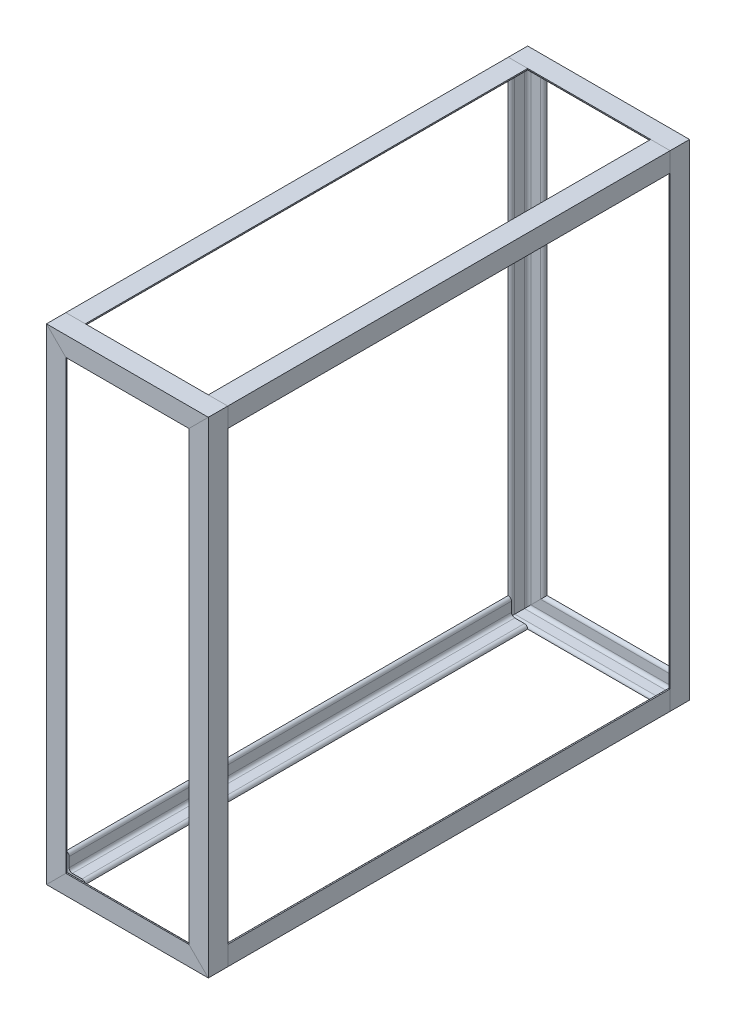
from build123d import *

# Parameters (mm, degrees)
ANGLE_IRON_CONFIGURED_35_X_35_X_5_1_DEPTH      = 293.426406871
ANGLE_IRON_CONFIGURED_35_X_35_X_5_1_DEPTH_BACK = 43.426406871
ANGLE_IRON_CONFIGURED_35_X_35_X_5_1_2_DEPTH    = 836.852813742
ANGLE_IRON_CONFIGURED_35_X_35_X_5_1_3_DEPTH    = 336.852813742
ANGLE_IRON_CONFIGURED_35_X_35_X_5_1_4_DEPTH    = 836.852813742
ANGLE_START                                    = -713.2
ANGLE_IRON_CONFIGURED_35_X_35_X_5_9_DEPTH      = 683.2


# Read off the part's stored shape, not the designer's step: Angle iron - configured 35 X 35 X 5(2)
with BuildPart() as part:
    # Sketch11 → Angle iron - configured 35 X 35 X 5(1) (new, two sides: drawn at the far end of the back side and taken through both)
    with BuildSketch(Plane(origin=(-125, 375, 0), x_dir=(0, -1, 0), z_dir=(1, 0, 0)).offset(-ANGLE_IRON_CONFIGURED_35_X_35_X_5_1_DEPTH_BACK)):
        with BuildLine():
            Line((0, 0), (0, 30))
            ThreePointArc((0, 30), (3.535533906, 28.535533906), (5, 25))
            Line((5, 25), (5, 10))
            ThreePointArc((5, 10), (6.464466094, 6.464466094), (10, 5))
            Line((10, 5), (25, 5))
            ThreePointArc((25, 5), (28.535533906, 3.535533906), (30, 0))
            Line((30, 0), (0, 0))
        make_face()
    extrude(amount=ANGLE_IRON_CONFIGURED_35_X_35_X_5_1_DEPTH + ANGLE_IRON_CONFIGURED_35_X_35_X_5_1_DEPTH_BACK)

    # Angle iron - configured 35 X 35 X 5(1) mi
    split(bisect_by=Plane(origin=(-125, 375, 0), x_dir=(-0.707106781, 0.707106781, 0), z_dir=(0.707106781, 0.707106781, 0)), keep=Keep.TOP)

    # Angle iron - configured 35 X 35 X 5_ 2
    split(bisect_by=Plane(origin=(125, 375, 0), x_dir=(-0.707106781, -0.707106781, 0), z_dir=(-0.707106781, 0.707106781, 0)), keep=Keep.TOP)


with BuildPart() as body_2:
    # Sketch11 on segment 2 (carried to segment 2) → Angle iron - configured 35 X 35 X 5_1 2 (new body)
    with BuildSketch(Plane(origin=(125, 418.426406871, 0), x_dir=(-1, 0, 0), z_dir=(0, -1, 0))):
        with BuildLine():
            Line((0, 0), (0, 30))
            ThreePointArc((0, 30), (3.535533906, 28.535533906), (5, 25))
            Line((5, 25), (5, 10))
            ThreePointArc((5, 10), (6.464466094, 6.464466094), (10, 5))
            Line((10, 5), (25, 5))
            ThreePointArc((25, 5), (28.535533906, 3.535533906), (30, 0))
            Line((30, 0), (0, 0))
        make_face()
    extrude(amount=ANGLE_IRON_CONFIGURED_35_X_35_X_5_1_2_DEPTH)

    # Angle iron - configured 35 X 35 X 5_ 3
    split(bisect_by=Plane(origin=(125, -375, 0), x_dir=(-0.707106781, 0.707106781, 0), z_dir=(0.707106781, 0.707106781, 0)), keep=Keep.TOP)

    # Angle iron - configured 35 X 35 X 5_ 4
    split(bisect_by=Plane(origin=(125, 375, 0), x_dir=(0.707106781, 0.707106781, 0), z_dir=(0.707106781, -0.707106781, 0)), keep=Keep.TOP)


with BuildPart() as body_3:
    # Sketch11 on segment 3 (carried to segment 3) → Angle iron - configured 35 X 35 X 5_1 3 (new body)
    with BuildSketch(Plane(origin=(168.426406871, -375, 0), x_dir=(0, 1, 0), z_dir=(-1, 0, 0))):
        with BuildLine():
            Line((0, 0), (0, 30))
            ThreePointArc((0, 30), (3.535533906, 28.535533906), (5, 25))
            Line((5, 25), (5, 10))
            ThreePointArc((5, 10), (6.464466094, 6.464466094), (10, 5))
            Line((10, 5), (25, 5))
            ThreePointArc((25, 5), (28.535533906, 3.535533906), (30, 0))
            Line((30, 0), (0, 0))
        make_face()
    extrude(amount=ANGLE_IRON_CONFIGURED_35_X_35_X_5_1_3_DEPTH)

    # Angle iron - configured 35 X 35 X 5_ 5
    split(bisect_by=Plane(origin=(-125, -375, 0), x_dir=(0.707106781, 0.707106781, 0), z_dir=(0.707106781, -0.707106781, 0)), keep=Keep.TOP)

    # Angle iron - configured 35 X 35 X 5_ 6
    split(bisect_by=Plane(origin=(125, -375, 0), x_dir=(0.707106781, -0.707106781, 0), z_dir=(-0.707106781, -0.707106781, 0)), keep=Keep.TOP)


with BuildPart() as body_4:
    # Sketch11 on segment 4 (carried to segment 4) → Angle iron - configured 35 X 35 X 5_1 4 (new body)
    with BuildSketch(Plane(origin=(-125, -418.426406871, 0), x_dir=(1, 0, 0), z_dir=(0, 1, 0))):
        with BuildLine():
            Line((0, 0), (0, 30))
            ThreePointArc((0, 30), (3.535533906, 28.535533906), (5, 25))
            Line((5, 25), (5, 10))
            ThreePointArc((5, 10), (6.464466094, 6.464466094), (10, 5))
            Line((10, 5), (25, 5))
            ThreePointArc((25, 5), (28.535533906, 3.535533906), (30, 0))
            Line((30, 0), (0, 0))
        make_face()
    extrude(amount=ANGLE_IRON_CONFIGURED_35_X_35_X_5_1_4_DEPTH)

    # Angle iron - configured 35 X 35 X 5_ 7
    split(bisect_by=Plane(origin=(-125, -375, 0), x_dir=(-0.707106781, -0.707106781, 0), z_dir=(-0.707106781, 0.707106781, 0)), keep=Keep.TOP)

    # Angle iron - configured 35 X 35 X 5_ 8
    split(bisect_by=Plane(origin=(-125, 375, 0), x_dir=(0.707106781, -0.707106781, 0), z_dir=(-0.707106781, -0.707106781, 0)), keep=Keep.TOP)


with BuildPart() as body_5:
    # Mirror1: mirrored copy
    add(body_4.part.mirror(Plane.XY.offset(-371.6)))


with BuildPart() as body_6:
    # Mirror1 2: mirrored copy
    add(part.part.mirror(Plane.XY.offset(-371.6)))


with BuildPart() as body_7:
    # Mirror1 3: mirrored copy
    add(body_2.part.mirror(Plane.XY.offset(-371.6)))


with BuildPart() as body_8:
    # Mirror1 4: mirrored copy
    add(body_3.part.mirror(Plane.XY.offset(-371.6)))


with BuildPart() as body_9:
    # Angle iron - configured 35 X 35 X 5_ 9 o → Angle iron - configured 35 X 35 X 5_ 9 (new body)
    with BuildSketch(Plane.XY.offset(ANGLE_START)):
        with BuildLine():
            Line((-125, -345), (-125, -375))
            Line((-125, -375), (-95, -375))
            ThreePointArc((-95, -375), (-96.464466094, -371.464466094), (-100, -370))
            Line((-100, -370), (-115, -370))
            ThreePointArc((-115, -370), (-118.535533906, -368.535533906), (-120, -365))
            Line((-120, -365), (-120, -350))
            ThreePointArc((-120, -350), (-121.464466094, -346.464466094), (-125, -345))
        make_face()
        with BuildLine():
            Line((-125, 375), (-125, 345))
            ThreePointArc((-125, 345), (-121.464466094, 346.464466094), (-120, 350))
            Line((-120, 350), (-120, 365))
            ThreePointArc((-120, 365), (-118.535533906, 368.535533906), (-115, 370))
            Line((-115, 370), (-100, 370))
            ThreePointArc((-100, 370), (-96.464466094, 371.464466094), (-95, 375))
            Line((-95, 375), (-125, 375))
        make_face()
        with BuildLine():
            Line((115, -370), (100, -370))
            ThreePointArc((100, -370), (96.464466094, -371.464466094), (95, -375))
            Line((95, -375), (125, -375))
            Line((125, -375), (125, -345))
            ThreePointArc((125, -345), (121.464466094, -346.464466094), (120, -350))
            Line((120, -350), (120, -365))
            ThreePointArc((120, -365), (118.535533906, -368.535533906), (115, -370))
        make_face()
        with BuildLine():
            Line((125, 345), (125, 375))
            Line((125, 375), (95, 375))
            ThreePointArc((95, 375), (96.464466094, 371.464466094), (100, 370))
            Line((100, 370), (115, 370))
            ThreePointArc((115, 370), (118.535533906, 368.535533906), (120, 365))
            Line((120, 365), (120, 350))
            ThreePointArc((120, 350), (121.464466094, 346.464466094), (125, 345))
        make_face()
    extrude(amount=ANGLE_IRON_CONFIGURED_35_X_35_X_5_9_DEPTH)


solid = Compound([part.part, body_2.part, body_3.part, body_4.part, body_5.part, body_6.part, body_7.part, body_8.part, body_9.part])
